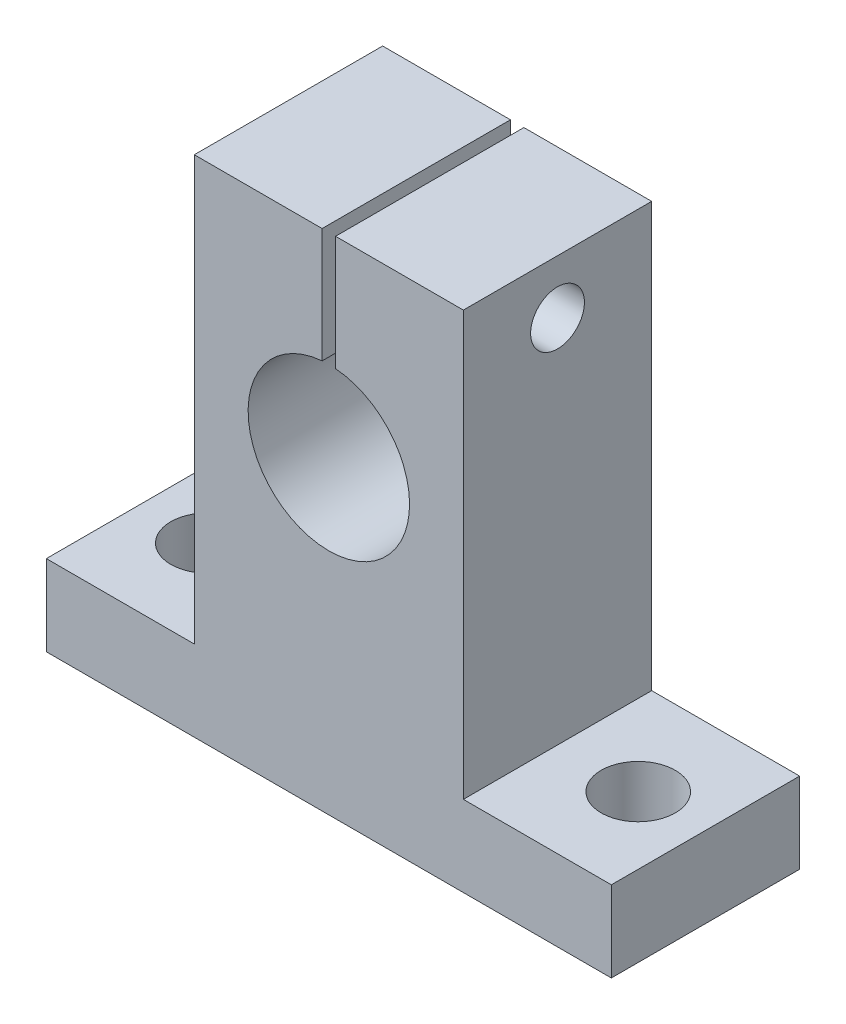
from build123d import *

# Parameters (mm, degrees)
SKETCH1_R           = 6
BOSS_EXTRUDE1_DEPTH = 14
SKETCH3_W           = 1
SKETCH3_H           = 16.490173319
CUT_EXTRUDE1_DEPTH  = 19
SKETCH2_R           = 2
CUT_EXTRUDE3_DEPTH  = 31
SKETCH5_R           = 2.75
CUT_EXTRUDE5_DEPTH  = 22


with BuildPart() as part:
    # Sketch1 → Boss-Extrude1 (new body)
    with BuildSketch(Plane.XY):
        Polygon((-21, 0), (21, 0), (21, 6), (10, 6), (10, 37.5), (-10, 37.5), (-10, 6), (-21, 6), align=None)
        with Locations((0, 23)):
            Circle(SKETCH1_R, mode=Mode.SUBTRACT)
    extrude(amount=BOSS_EXTRUDE1_DEPTH)

    # Sketch3 → Cut-Extrude1 (cut)
    with BuildSketch(Plane.XY.offset(14)):
        with Locations((0, 29.25491334)):
            Rectangle(SKETCH3_W, SKETCH3_H)
    extrude(amount=-CUT_EXTRUDE1_DEPTH, mode=Mode.SUBTRACT)

    # Sketch2 → Cut-Extrude3 (cut)
    with BuildSketch(Plane(origin=(10, 0, 0), x_dir=(0, 0, -1), z_dir=(1, 0, 0))):
        with Locations((-7, 33.5)):
            Circle(SKETCH2_R)
    extrude(amount=-CUT_EXTRUDE3_DEPTH, mode=Mode.SUBTRACT)

    # Sketch5 → Cut-Extrude5 (cut)
    with BuildSketch(Plane(origin=(0, 6, 0), x_dir=(1, 0, 0), z_dir=(0, 1, 0))):
        with Locations((16, -7)):
            Circle(SKETCH5_R)
        with Locations((-16, -7)):
            Circle(SKETCH5_R)
    extrude(amount=-CUT_EXTRUDE5_DEPTH, mode=Mode.SUBTRACT)


solid = part.part
